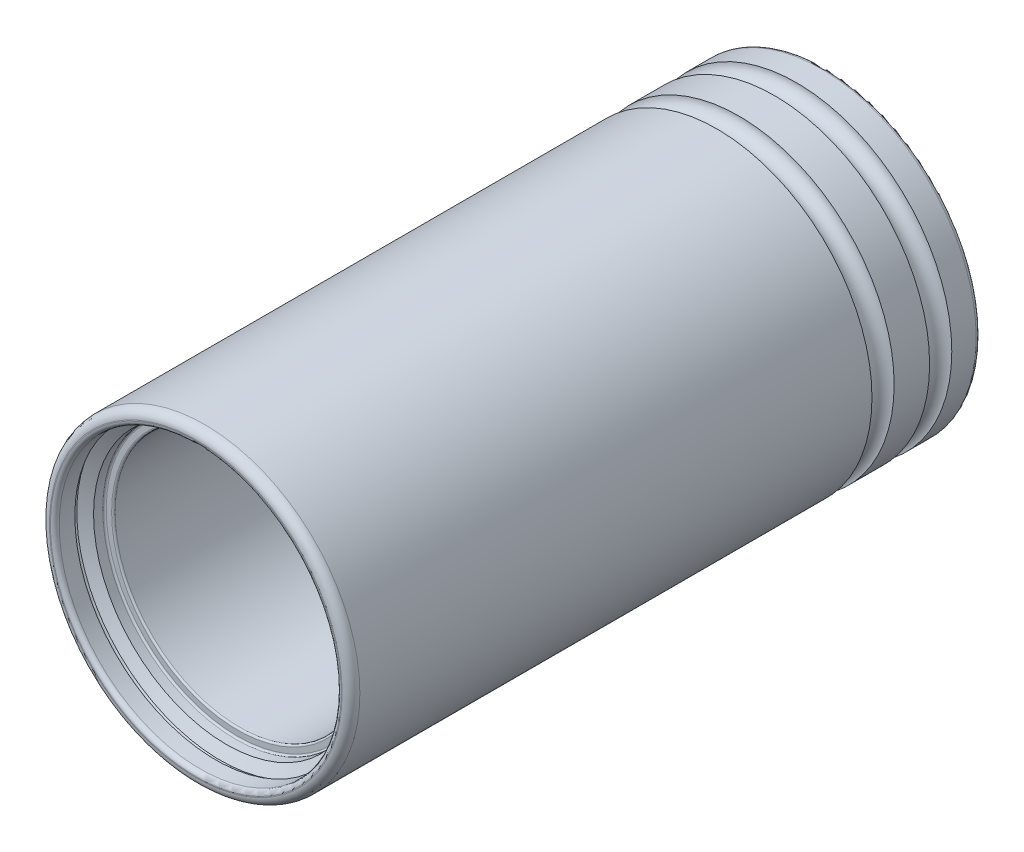
from build123d import *

# Parameters (mm, degrees)
SKETCH_1_R          = 17.500000000000004
EXTRUDE_1_DEPTH     = 71
FILLET_1_R          = 0.2
FILLET_2_R          = 1
CUT_EXTRUDE_START   = -2.6
SKETCH_6_R          = 15.9
SKETCH_6_R_2        = 13.999999999999993
CUT_EXTRUDE_1_DEPTH = 2.6
FILLET_3_R          = 0.5
FILLET_4_R          = 0.1
FILLET_5_R          = 0.2
FILLET_6_R          = 0.4
FILLET_7_R          = 0.2
SKETCH_8_R          = 1.2499999999999978
FILLET_10_R         = 0.2
FILLET_11_R         = 0.5


with BuildPart() as part:
    # Эскиз1 → Бобышка-Вытянуть1 (new body)
    with BuildSketch(Plane.XY):
        Circle(SKETCH_1_R)
    extrude(amount=-EXTRUDE_1_DEPTH)

    # Эскиз4 → Вырез-Повернуть1 (revolve, cut)
    with BuildSketch(Plane(origin=(0, 0, 0), x_dir=(0, 0, -1), z_dir=(1, 0, 0)), mode=Mode.PRIVATE) as cut_revolve_1_sk:
        with BuildLine():
            Line((0, 0), (0, 14.999999999999991))
            Line((0, 14.999999999999991), (4.7, 14.999999999999991))
            Line((4.7, 14.999999999999991), (4.7, 13.999999999999991))
            Line((4.7, 13.999999999999991), (23.5, 13.999999999999991))
            Line((23.5, 13.999999999999991), (23.5, 10.999999999999995))
            Line((23.5, 10.999999999999995), (29.300069642348248, 9.499999999999998))
            Line((29.300069642348248, 9.499999999999998), (29.353589838486226, 9.499999999999998))
            Line((29.353589838486226, 9.499999999999998), (29.353589838486215, 10.09999999999999))
            Line((29.353589838486215, 10.09999999999999), (30.553589838486214, 10.099999999999993))
            Line((30.553589838486214, 10.099999999999993), (30.9, 9.499999999999998))
            Line((30.9, 9.499999999999998), (45, 9.499999999999998))
            Line((45, 9.499999999999998), (45, 7.4999999999999964))
            Line((45, 7.4999999999999964), (45.52359326115654, 5.4999999999999964))
            Line((45.52359326115654, 5.4999999999999964), (47.99999999999999, 5.4999999999999964))
            Line((47.99999999999999, 5.4999999999999964), (47.99999999999999, 9.499999999999998))
            Line((47.99999999999999, 9.499999999999998), (51.79999999999998, 9.5))
            ThreePointArc((51.79999999999998, 9.5), (52.39999999999999, 10.100000000000005), (52.99999999999999, 9.5))
            Line((52.99999999999999, 9.5), (54.49999999999999, 9.499999999999998))
            Line((54.49999999999999, 9.499999999999998), (54.49999999999999, 10.75))
            Line((54.49999999999999, 10.75), (65.99999999999999, 10.75))
            Line((65.99999999999999, 10.75), (65.99999999999999, 12.4))
            Line((65.99999999999999, 12.4), (68.99999999999999, 12.4))
            Line((68.99999999999999, 12.4), (68.99999999999999, 10.75))
            Line((68.99999999999999, 10.75), (71, 10.75))
            Line((71, 10.75), (71, 0))
            Line((71, 0), (0, 0))
        make_face()
    revolve(cut_revolve_1_sk.sketch.rotate(Axis((0, 0, -71), (0, 0, 1)), 90), axis=Axis((0, 0, -71), (0, 0, 1)), mode=Mode.SUBTRACT)

    # Эскиз5 → Вырез-Повернуть2 (revolve, cut)
    with BuildSketch(Plane(origin=(0, 0, 0), x_dir=(0, 0, -1), z_dir=(1, 0, 0)), mode=Mode.PRIVATE) as cut_revolve_2_sk:
        Polygon((3.4660254037844416, 14.999999999999991), (1.733974596215558, 14.999999999999991), (2.6, 16.500000000000004), align=None)
    revolve(cut_revolve_2_sk.sketch.rotate(Axis((0, 0, 0), (0, 0, -1)), 270), axis=Axis((0, 0, 0), (0, 0, -1)), mode=Mode.SUBTRACT)

    # Скругление1
    fillet_1_edges = [part.edges().sort_by_distance(p)[0] for p in [
        (16.500000000000004, 5.68e-15, -2.6),
        (14.999999999999991, -3.5e-15, -4.700000000000003),
    ]]
    fillet(fillet_1_edges, radius=FILLET_1_R)

    # Скругление2
    fillet_2_edges = [part.edges().sort_by_distance(p)[0] for p in [
        (-17.500000000000004, 2.14e-15, 0),
        (13.999999999999991, -3.27e-15, -23.5),
    ]]
    fillet(fillet_2_edges, radius=FILLET_2_R)

    # Эскиз6 → Вырез-Вытянуть1 (cut)
    with BuildSketch(Plane.XY.offset(CUT_EXTRUDE_START)):
        Circle(SKETCH_6_R)
        with Locations(Location((0, 0, 0), (0, 0, 180))):
            Circle(SKETCH_6_R_2, mode=Mode.SUBTRACT)
    extrude(amount=CUT_EXTRUDE_1_DEPTH, mode=Mode.SUBTRACT)

    # Скругление3
    # the kernel refuses this fillet: 0.5 mm, written as the material it takes off along each edge
    with BuildSketch(Plane(origin=(0, 0, -71), x_dir=(1, 0, 0), z_dir=(0, -1, 0))) as fillet_3_piece_1:
        with BuildLine():
            CenterArc((17.500000000000004 - FILLET_3_R, FILLET_3_R), FILLET_3_R, 270, 90)
            Line((17.500000000000004 - FILLET_3_R, 0), (17.500000000000004, 0))
            Line((17.500000000000004, 0), (17.500000000000004, FILLET_3_R))
        make_face()
    revolve(axis=Axis((0, 0, -71), (0, 0, 1)), mode=Mode.SUBTRACT)
    with BuildSketch(Plane(origin=(0, 0, -23.5), x_dir=(-1, 1.1e-16, 0), z_dir=(1.1e-16, 1, 0))) as fillet_3_piece_2:
        with BuildLine():
            CenterArc((10.999999999999995 + FILLET_3_R * 0.774282727842, -FILLET_3_R), FILLET_3_R, 90, 75.5000000000004)
            Line((10.999999999999995 - FILLET_3_R * 0.193864912536, -FILLET_3_R * 0.749619995946), (10.999999999999995, 0))
            Line((10.999999999999995, 0), (10.999999999999995 + FILLET_3_R * 0.774282727842, 0))
        make_face()
    revolve(axis=Axis((0, 0, -23.5), (0, 0, 1)), mode=Mode.SUBTRACT)
    with BuildSketch(Plane(origin=(0, 0, -29.300069642348248), x_dir=(-1, 1.1e-16, 0), z_dir=(1.1e-16, 1, 0))) as fillet_3_piece_3:
        with BuildLine():
            CenterArc((9.499999999999998 + FILLET_3_R, -FILLET_3_R * 0.127216068001), FILLET_3_R, 165.5000000000004, 14.499999999999602)
            Line((9.499999999999998, -FILLET_3_R * 0.127216068001), (9.499999999999998, 0))
            Line((9.499999999999998, 0), (9.499999999999998 + FILLET_3_R * 0.0318523596219, FILLET_3_R * 0.123163936053))
        make_face()
    revolve(axis=Axis((0, 0, -29.300069642348248), (0, 0, 1)), mode=Mode.SUBTRACT)
    with BuildSketch(Plane(origin=(0, 0, -45.52359326115654), x_dir=(-1, 1.1e-16, 0), z_dir=(1.1e-16, 1, 0))) as fillet_3_piece_4:
        with BuildLine():
            CenterArc((5.4999999999999964 + FILLET_3_R, -FILLET_3_R * 0.771904233203), FILLET_3_R, 104.67059520838349, 75.32940479161653)
            Line((5.4999999999999964 + FILLET_3_R * 0.74673850071, FILLET_3_R * 0.195493623409), (5.4999999999999964, 0))
            Line((5.4999999999999964, 0), (5.4999999999999964, -FILLET_3_R * 0.771904233203))
        make_face()
    revolve(axis=Axis((0, 0, -45.52359326115654), (0, 0, 1)), mode=Mode.SUBTRACT)
    with BuildSketch(Plane(origin=(0, 0, -47.99999999999999), x_dir=(-1, 1.1e-16, 0), z_dir=(1.1e-16, 1, 0))) as fillet_3_piece_5:
        with BuildLine():
            CenterArc((5.4999999999999964 + FILLET_3_R, FILLET_3_R), FILLET_3_R, 180, 90)
            Line((5.4999999999999964, FILLET_3_R), (5.4999999999999964, 0))
            Line((5.4999999999999964, 0), (5.4999999999999964 + FILLET_3_R, 0))
        make_face()
    revolve(axis=Axis((0, 0, -47.99999999999999), (0, 0, 1)), mode=Mode.SUBTRACT)
    with BuildSketch(Plane(origin=(0, 0, -71), x_dir=(-1, 1.1e-16, 0), z_dir=(1.1e-16, 1, 0))) as fillet_3_piece_6:
        with BuildLine():
            CenterArc((10.75 + FILLET_3_R, FILLET_3_R), FILLET_3_R, 180, 90)
            Line((10.75, FILLET_3_R), (10.75, 0))
            Line((10.75, 0), (10.75 + FILLET_3_R, 0))
        make_face()
    revolve(axis=Axis((0, 0, -71), (0, 0, 1)), mode=Mode.SUBTRACT)

    # Скругление4
    fillet_4_edges = [part.edges().sort_by_distance(p)[0] for p in [
        (10.09999999999999, -2.36e-15, -29.353589838486215),
        (10.099999999999993, -2.36e-15, -30.553589838486218),
    ]]
    fillet(fillet_4_edges, radius=FILLET_4_R)

    # Скругление5
    fillet_5_edges = [part.edges().sort_by_distance(p)[0] for p in [
        (9.499999999999998, -2.22e-15, -30.9),
        (10.75, -2.51e-15, -65.99999999999999),
        (10.75, -2.51e-15, -68.99999999999999),
    ]]
    fillet(fillet_5_edges, radius=FILLET_5_R)

    # Скругление6
    fillet_6_edges = [part.edges().sort_by_distance(p)[0] for p in [
        (12.4, -2.9e-15, -65.99999999999999),
        (12.4, -2.9e-15, -68.99999999999999),
    ]]
    fillet(fillet_6_edges, radius=FILLET_6_R)

    # Скругление7
    fillet_7_edges = [part.edges().sort_by_distance(p)[0] for p in [
        (13.999999999999991, -3.27e-15, -4.700000000000003),
        (9.499999999999998, -2.22e-15, -54.49999999999999),
        (10.75, -2.51e-15, -54.49999999999999),
    ]]
    fillet(fillet_7_edges, radius=FILLET_7_R)

    # Эскиз7 → Повернуть1 (revolve)
    with BuildSketch(Plane(origin=(0, 0, 0), x_dir=(1, 0, 0), z_dir=(0, 1, 0)), mode=Mode.PRIVATE) as revolve_1_sk:
        with BuildLine():
            Line((-15.75000000000001, 71), (-13.250000000000009, 71))
            ThreePointArc((-13.250000000000009, 71), (-14.500000000000009, 72.25), (-15.75000000000001, 71))
        make_face()
    revolve(revolve_1_sk.sketch.rotate(Axis((0, 0, -88.95887593337878), (0, 0, 1)), 180), axis=Axis((0, 0, -88.95887593337878), (0, 0, 1)))

    # Эскиз8 → Вырез-Повернуть3 (revolve, cut)
    with BuildSketch(Plane(origin=(0, 0, 0), x_dir=(0, 0, -1), z_dir=(1, 0, 0)), mode=Mode.PRIVATE) as cut_revolve_3_sk:
        with Locations((66.49999999999997, 17.500000000000004)):
            Circle(SKETCH_8_R)
        with Locations((59.999999999999986, 17.500000000000004)):
            Circle(SKETCH_8_R)
    revolve(cut_revolve_3_sk.sketch.rotate(Axis((0, 0, 0), (0, 0, -1)), 90), axis=Axis((0, 0, 0), (0, 0, -1)), mode=Mode.SUBTRACT)

    # Скругление10
    fillet_10_edges = [part.edges().sort_by_distance(p)[0] for p in [
        (9.499999999999998, -2.22e-15, -47.99999999999999),
    ]]
    fillet(fillet_10_edges, radius=FILLET_10_R)

    # Скругление11
    fillet_11_edges = [part.edges().sort_by_distance(p)[0] for p in [
        (-15.9, 1.95e-15, 0),
    ]]
    fillet(fillet_11_edges, radius=FILLET_11_R)


solid = part.part
